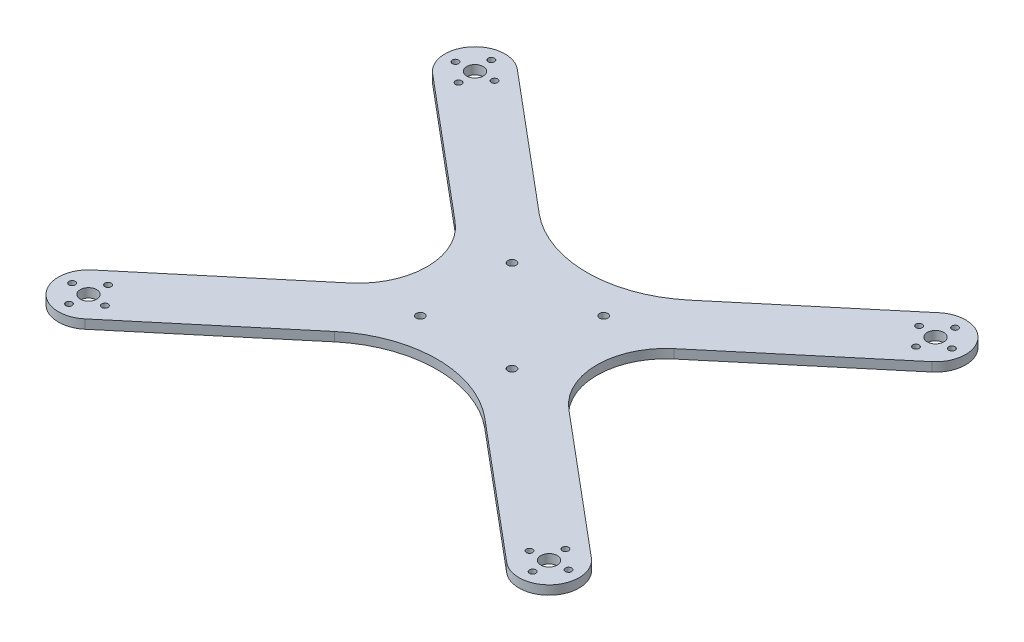
from build123d import *

# Parameters (mm, degrees)
SKETCH2_R           = 1.05
SKETCH2_R_2         = 2.75
BOSS_EXTRUDE2_DEPTH = 3
SKETCH4_R           = 1.375
CUT_EXTRUDE1_DEPTH  = 3


with BuildPart() as part:
    # Sketch2 → Boss-Extrude2 (new body)
    with BuildSketch(Plane(origin=(0, 0, 0), x_dir=(1, 0, 0), z_dir=(0, 1, 0))):
        with BuildLine():
            Line((-83.032320409, 56.618316537), (-36.412926139, 17.5))
            ThreePointArc((-36.412926139, 17.5), (-28.252542121, 0), (-36.412926139, -17.5))
            Line((-36.412926139, -17.5), (-83.032320409, -56.618316537))
            ThreePointArc((-83.032320409, -56.618316537), (-84.264888743, -70.706637066), (-70.176568215, -71.9392054))
            Line((-70.176568215, -71.9392054), (-25, -34.031563673))
            ThreePointArc((-25, -34.031563673), (0, -24.932307816), (25, -34.031563673))
            Line((25, -34.031563673), (70.176568215, -71.9392054))
            ThreePointArc((70.176568215, -71.9392054), (84.264888743, -70.706637066), (83.032320409, -56.618316537))
            Line((83.032320409, -56.618316537), (36.412926139, -17.5))
            ThreePointArc((36.412926139, -17.5), (28.252542121, 0), (36.412926139, 17.5))
            Line((36.412926139, 17.5), (83.032320409, 56.618316537))
            ThreePointArc((83.032320409, 56.618316537), (84.264888743, 70.706637066), (70.176568215, 71.9392054))
            Line((70.176568215, 71.9392054), (25, 34.031563673))
            ThreePointArc((25, 34.031563673), (0, 24.932307816), (-25, 34.031563673))
            Line((-25, 34.031563673), (-70.176568215, 71.9392054))
            ThreePointArc((-70.176568215, 71.9392054), (-84.264888743, 70.706637066), (-83.032320409, 56.618316537))
        make_face()
        with Locations((-77.127378768, 70.255929157)):
            Circle(SKETCH2_R, mode=Mode.SUBTRACT)
        with Locations((-70.627276123, 64.801695425)):
            Circle(SKETCH2_R, mode=Mode.SUBTRACT)
        with Locations((-76.081509855, 58.30159278)):
            Circle(SKETCH2_R, mode=Mode.SUBTRACT)
        with Locations((-82.5816125, 63.755826512)):
            Circle(SKETCH2_R, mode=Mode.SUBTRACT)
        with Locations((-76.604444312, 64.278760969)):
            Circle(SKETCH2_R_2, mode=Mode.SUBTRACT)
        with Locations((-77.127378768, -70.255929157)):
            Circle(SKETCH2_R, mode=Mode.SUBTRACT)
        with Locations((-76.081509855, -58.30159278)):
            Circle(SKETCH2_R, mode=Mode.SUBTRACT)
        with Locations((-82.5816125, -63.755826512)):
            Circle(SKETCH2_R, mode=Mode.SUBTRACT)
        with Locations((-76.604444312, -64.278760969)):
            Circle(SKETCH2_R_2, mode=Mode.SUBTRACT)
        with Locations((-70.627276123, -64.801695425)):
            Circle(SKETCH2_R, mode=Mode.SUBTRACT)
        with Locations((70.627276123, -64.801695425)):
            Circle(SKETCH2_R, mode=Mode.SUBTRACT)
        with Locations((76.604444312, -64.278760969)):
            Circle(SKETCH2_R_2, mode=Mode.SUBTRACT)
        with Locations((82.5816125, -63.755826512)):
            Circle(SKETCH2_R, mode=Mode.SUBTRACT)
        with Locations((76.081509855, -58.30159278)):
            Circle(SKETCH2_R, mode=Mode.SUBTRACT)
        with Locations((77.127378768, -70.255929157)):
            Circle(SKETCH2_R, mode=Mode.SUBTRACT)
        with Locations((76.604444312, 64.278760969)):
            Circle(SKETCH2_R_2, mode=Mode.SUBTRACT)
        with Locations((82.5816125, 63.755826512)):
            Circle(SKETCH2_R, mode=Mode.SUBTRACT)
        with Locations((76.081509855, 58.30159278)):
            Circle(SKETCH2_R, mode=Mode.SUBTRACT)
        with Locations((70.627276123, 64.801695425)):
            Circle(SKETCH2_R, mode=Mode.SUBTRACT)
        with Locations((77.127378768, 70.255929157)):
            Circle(SKETCH2_R, mode=Mode.SUBTRACT)
    extrude(amount=BOSS_EXTRUDE2_DEPTH)

    # Sketch4 → Cut-Extrude1 (cut)
    with BuildSketch(Plane(origin=(0, 0, 0), x_dir=(1, 0, 0), z_dir=(0, 1, 0))):
        with Locations((-15.25, 15.25)):
            Circle(SKETCH4_R)
        with Locations((15.25, -15.25)):
            Circle(SKETCH4_R)
        with Locations((-15.25, -15.25)):
            Circle(SKETCH4_R)
        with Locations((15.25, 15.25)):
            Circle(SKETCH4_R)
    extrude(amount=CUT_EXTRUDE1_DEPTH, mode=Mode.SUBTRACT)


solid = part.part
